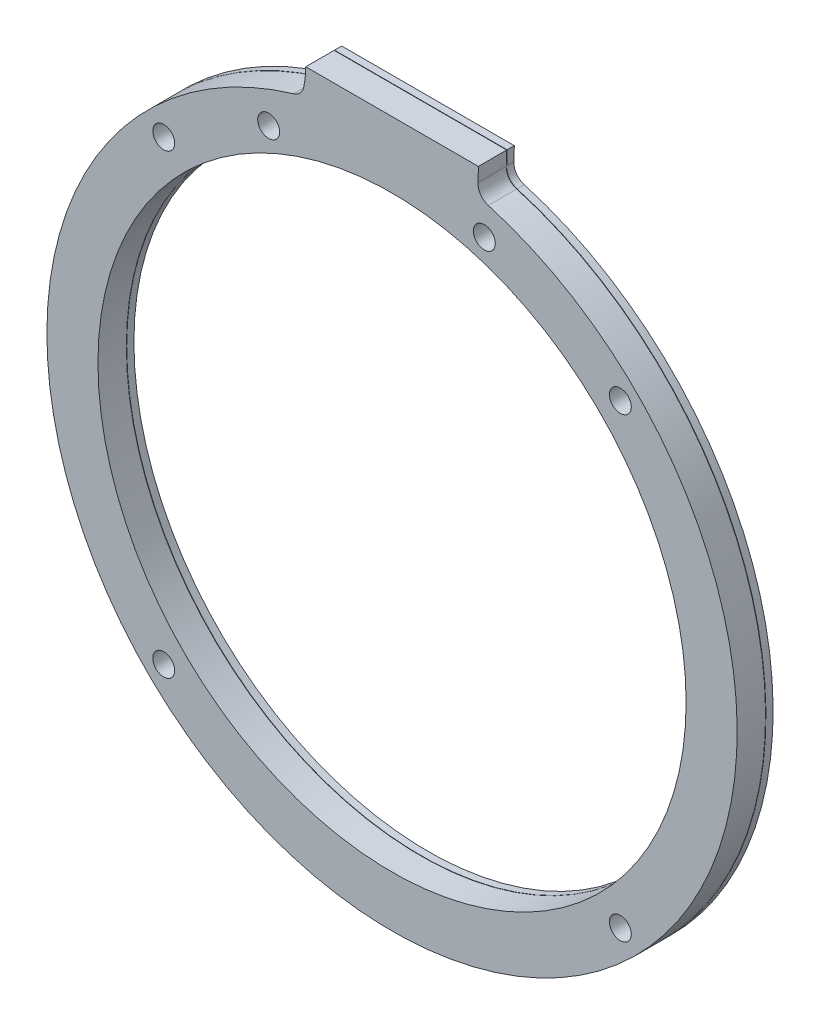
from build123d import *

# Parameters (mm, degrees)
SKETCH_1_R               = 40.9
SKETCH_1_R_2             = 1.525
EXTRUDE_1_DEPTH          = 5
SKETCH_2_R               = 1.525
CUT_EXTRUDE_1_DEPTH      = 10
CUT_EXTRUDE_2_DEPTH      = 70.562993035
CUT_EXTRUDE_2_DEPTH_BACK = 70.562993035
SKETCH_3_W               = 107.831204027
SKETCH_3_H               = 0.05


with BuildPart() as part:
    # 草图1 → 凸台-拉伸1 (new body)
    with BuildSketch(Plane.XY):
        with BuildLine():
            Line((-12, 50.1), (12, 50.1))
            ThreePointArc((12, 50.1), (11.98646104, 49.112770637), (11.945854344, 48.126283833))
            ThreePointArc((11.945854344, 48.126283833), (12.311228539, 46.859989672), (13.385132402, 46.095967617))
            ThreePointArc((13.385132402, 46.095967617), (0.147817484, -47.999772395), (-13.668785094, 46.012653847))
            ThreePointArc((-13.668785094, 46.012653847), (-12.775478285, 46.565992731), (-12.285981368, 47.495817309))
            ThreePointArc((-12.285981368, 47.495817309), (-12.071709603, 48.790080839), (-12, 50.1))
        make_face()
        Circle(SKETCH_1_R, mode=Mode.SUBTRACT)
        with Locations((-17.153096541, 40.410163067)):
            Circle(SKETCH_1_R_2, mode=Mode.SUBTRACT)
        with Locations((12.835117837, 41.981778787)):
            Circle(SKETCH_1_R_2, mode=Mode.SUBTRACT)
    extrude(amount=EXTRUDE_1_DEPTH)

    # 草图2 → 切除-拉伸1 (cut)
    with BuildSketch(Plane.XY.offset(5)):
        with Locations((-31.749094475, 31.749094475)):
            Circle(SKETCH_2_R)
        with Locations((31.749094475, 31.749094475)):
            Circle(SKETCH_2_R)
        with Locations((31.749094475, -31.749094475)):
            Circle(SKETCH_2_R)
        with Locations((-31.749094475, -31.749094475)):
            Circle(SKETCH_2_R)
    extrude(amount=-CUT_EXTRUDE_1_DEPTH, mode=Mode.SUBTRACT)

    # 草图3 → 切除-拉伸2 (cut, two sides: drawn at the far end of the back side and taken through both)
    with BuildSketch(Plane(origin=(0, 0, 0), x_dir=(1, 0, 0), z_dir=(0, 1, 0)).offset(-CUT_EXTRUDE_2_DEPTH_BACK)):
        with Locations((1.429580357, -1.025)):
            Rectangle(SKETCH_3_W, SKETCH_3_H)
    extrude(amount=CUT_EXTRUDE_2_DEPTH + CUT_EXTRUDE_2_DEPTH_BACK, mode=Mode.SUBTRACT)


with BuildPart() as cut_extrude_2_piece_1:
    # of the separate pieces the step leaves, piece 1, a body of its own (cut_extrude_2_pieces)
    add(part.part.solids().sort_by_distance((-12.285981368, 47.495817309, 1.05))[0])


with BuildPart() as cut_extrude_2_piece_2:
    # of the separate pieces the step leaves, piece 2, a body of its own (cut_extrude_2_pieces)
    add(part.part.solids().sort_by_distance((-13.668785094, 46.012653847, 0))[0])


solid = Compound([cut_extrude_2_piece_1.part, cut_extrude_2_piece_2.part])
